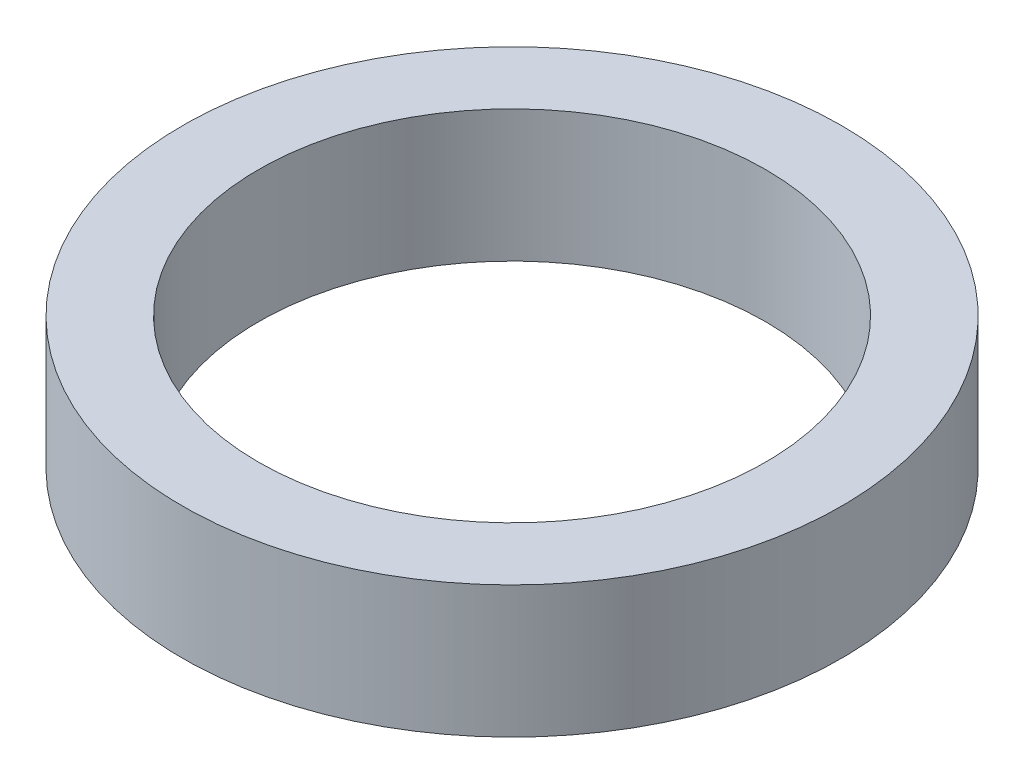
from build123d import *

# Parameters (mm, degrees)
SKETCH1_R           = 65
BOSS_EXTRUDE1_DEPTH = 26
SKETCH2_R           = 50
CUT_EXTRUDE1_DEPTH  = 96.530099969


with BuildPart() as part:
    # Sketch1 → Boss-Extrude1 (new body)
    with BuildSketch(Plane(origin=(0, 0, 0), x_dir=(1, 0, 0), z_dir=(0, 1, 0))):
        Circle(SKETCH1_R)
    extrude(amount=BOSS_EXTRUDE1_DEPTH)

    # Sketch2 → Cut-Extrude1 (cut, through all)
    with BuildSketch(Plane(origin=(0, 0, 0), x_dir=(1, 0, 0), z_dir=(0, 1, 0))):
        Circle(SKETCH2_R)
    extrude(amount=CUT_EXTRUDE1_DEPTH, mode=Mode.SUBTRACT)


solid = part.part
